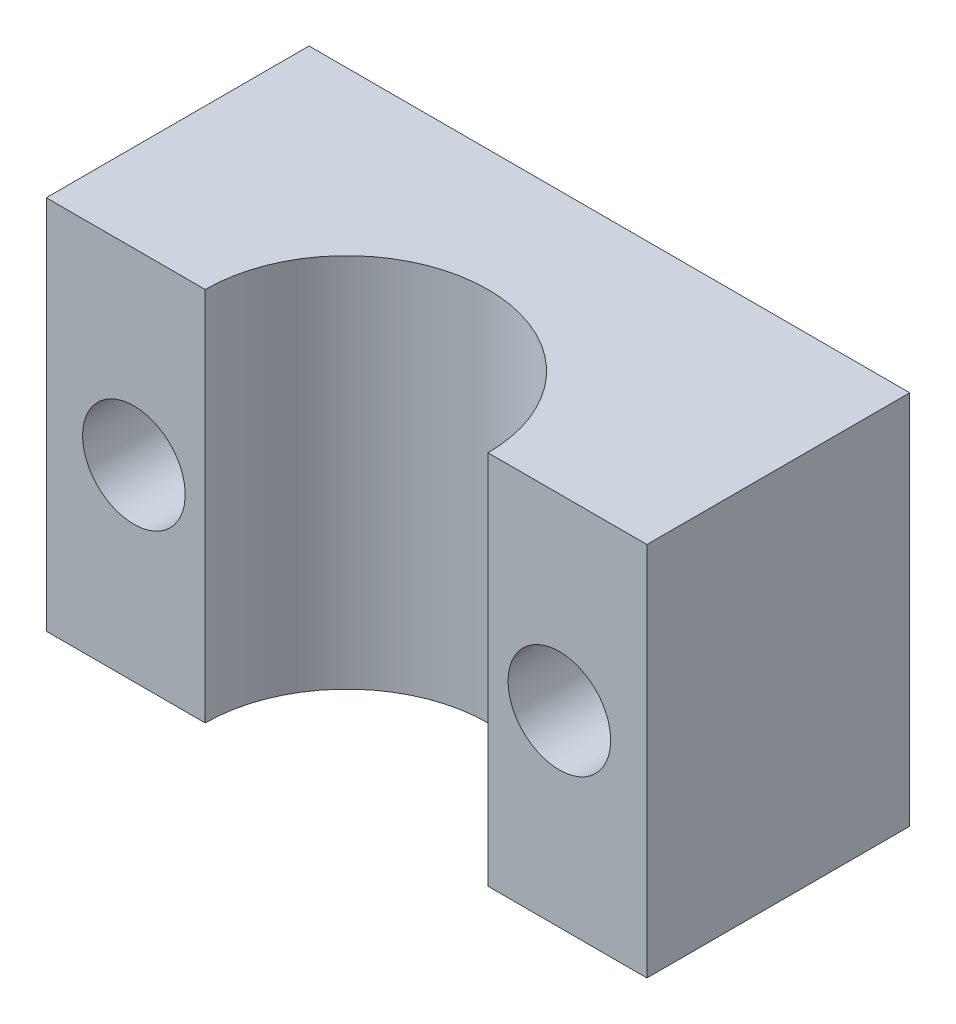
from build123d import *

# Parameters (mm, degrees)
SKETCH_1_W          = 48
SKETCH_1_H          = 20
EXTRUDE_1_DEPTH     = 30
SKETCH_2_W          = 14
SKETCH_2_H          = 30
CUT_EXTRUDE_1_DEPTH = 7
SKETCH_7_W          = 22
SKETCH_7_H          = 30
EXTRUDE_2_DEPTH     = 48
SKETCH_8_W          = 21
SKETCH_8_H          = 30
CUT_EXTRUDE_2_DEPTH = 14
SKETCH_9_W          = 21
SKETCH_9_H          = 30
CUT_EXTRUDE_3_DEPTH = 14
SKETCH_11_W         = 10.2
SKETCH_11_H         = 20.2
CUT_EXTRUDE_4_DEPTH = 56.497747702
SKETCH_13_R         = 4.1
CUT_EXTRUDE_5_DEPTH = 44.783558558
FILLET_1_R          = 7
SKETCH1_W           = 10.2
SKETCH1_H           = 20.2
BOSS_EXTRUDE1_DEPTH = 4
SKETCH2_W           = 20
SKETCH2_H           = 21
CUT_EXTRUDE1_DEPTH  = 51
SKETCH3_R           = 11.3
CUT_EXTRUDE2_DEPTH  = 40.962482405


with BuildPart() as part:
    # Эскиз1 → Бобышка-Вытянуть1 (new body)
    with BuildSketch(Plane(origin=(0, 0, 0), x_dir=(1, 0, 0), z_dir=(0, 1, 0))):
        Rectangle(SKETCH_1_W, SKETCH_1_H)
    extrude(amount=EXTRUDE_1_DEPTH)

    # Эскиз2 → Вырез-Вытянуть1 (cut)
    with BuildSketch(Plane.XY.offset(10)):
        with Locations((0, 15)):
            Rectangle(SKETCH_2_W, SKETCH_2_H)
    extrude(amount=-CUT_EXTRUDE_1_DEPTH, mode=Mode.SUBTRACT)

    # Эскиз7 → Бобышка-Вытянуть2 (add)
    with BuildSketch(Plane(origin=(24, 0, 0), x_dir=(0, 0, -1), z_dir=(1, 0, 0))):
        with Locations((21, 15)):
            Rectangle(SKETCH_7_W, SKETCH_7_H)
    extrude(amount=-EXTRUDE_2_DEPTH)

    # Эскиз8 → Вырез-Вытянуть2 (cut)
    with BuildSketch(Plane(origin=(24, 0, 0), x_dir=(0, 0, -1), z_dir=(1, 0, 0))):
        with Locations((21.5, 15)):
            Rectangle(SKETCH_8_W, SKETCH_8_H)
    extrude(amount=-CUT_EXTRUDE_2_DEPTH, mode=Mode.SUBTRACT)

    # Эскиз9 → Вырез-Вытянуть3 (cut)
    with BuildSketch(Plane.ZY.offset(24)):
        with Locations((-21.5, 15)):
            Rectangle(SKETCH_9_W, SKETCH_9_H)
    extrude(amount=-CUT_EXTRUDE_3_DEPTH, mode=Mode.SUBTRACT)

    # Эскиз11 → Вырез-Вытянуть4 (cut, through all)
    with BuildSketch(Plane.ZY.offset(10)):
        with Locations((-21.5, 15)):
            Rectangle(SKETCH_11_W, SKETCH_11_H)
    extrude(amount=-CUT_EXTRUDE_4_DEPTH, mode=Mode.SUBTRACT)

    # Эскиз13 → Вырез-Вытянуть5 (cut, through all)
    with BuildSketch(Plane(origin=(0, 0, -11), x_dir=(-1, 0, 0), z_dir=(0, 0, -1))):
        with Locations((17, 15)):
            Circle(SKETCH_13_R)
        with Locations((-17, 15)):
            Circle(SKETCH_13_R)
    extrude(amount=-CUT_EXTRUDE_5_DEPTH, mode=Mode.SUBTRACT)

    # Скругление1
    fillet_1_edges = [part.edges().sort_by_distance(p)[0] for p in [
        (-7, 15, 3),
        (7, 15, 3),
    ]]
    fillet(fillet_1_edges, radius=FILLET_1_R - 0.0001)  # a hair under: the kernel refuses the full size

    # Sketch1 → Boss-Extrude1 (add)
    with BuildSketch(Plane(origin=(10, 0, 0), x_dir=(0, 0, -1), z_dir=(1, 0, 0))):
        with Locations((21.5, 15)):
            Rectangle(SKETCH1_W, SKETCH1_H)
    extrude(amount=-BOSS_EXTRUDE1_DEPTH)

    # Sketch2 → Cut-Extrude1 (cut, through all)
    with BuildSketch(Plane(origin=(0, 30, 0), x_dir=(1, 0, 0), z_dir=(0, 1, 0))):
        with Locations((0, 21.5)):
            Rectangle(SKETCH2_W, SKETCH2_H)
    extrude(amount=-CUT_EXTRUDE1_DEPTH, mode=Mode.SUBTRACT)

    # Sketch3 → Cut-Extrude2 (cut, through all)
    with BuildSketch(Plane(origin=(0, 30, 0), x_dir=(1, 0, 0), z_dir=(0, 1, 0))):
        with Locations((0, -10)):
            Circle(SKETCH3_R)
    extrude(amount=-CUT_EXTRUDE2_DEPTH, mode=Mode.SUBTRACT)


solid = part.part
